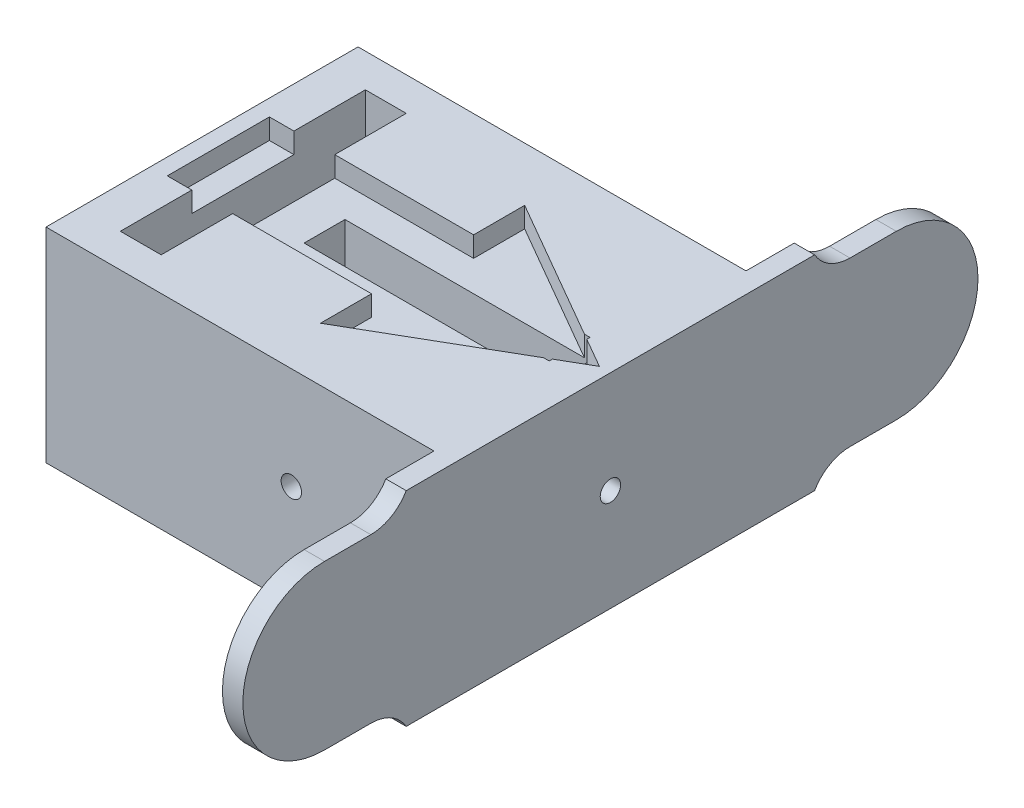
from build123d import *

# Parameters (mm, degrees)
SKETCH1_W           = 200
SKETCH1_H           = 200
BOSS_EXTRUDE2_DEPTH = 100
BOSS_EXTRUDE3_DEPTH = 10
CUT_EXTRUDE1_DEPTH  = 10
SKETCH4_W           = 120
SKETCH4_H           = 20
SKETCH4_W_2         = 20
SKETCH4_H_2         = 120
CUT_EXTRUDE2_DEPTH  = 229.910462845
SKETCH5_R           = 5
CUT_EXTRUDE3_DEPTH  = 314.687742827
SKETCH6_R           = 5
CUT_EXTRUDE4_DEPTH  = 288.054001888
SKETCH7_W           = 103.597474358
SKETCH7_H           = 100
CUT_EXTRUDE7_DEPTH  = 281.178514522
FILLET1_R           = 20


with BuildPart() as part:
    # Sketch1 → Boss-Extrude2 (new body)
    with BuildSketch(Plane(origin=(0, 0, 0), x_dir=(1, 0, 0), z_dir=(0, 1, 0))):
        Rectangle(SKETCH1_W, SKETCH1_H)
    extrude(amount=BOSS_EXTRUDE2_DEPTH)

    # Sketch2 → Boss-Extrude3 (add)
    with BuildSketch(Plane.ZY.offset(-100)):
        with BuildLine():
            Line((140, 10), (-140, 10))
            ThreePointArc((-140, 10), (-180, 50), (-140, 90))
            Line((-140, 90), (140, 90))
            ThreePointArc((140, 90), (180, 50), (140, 10))
        make_face()
    extrude(amount=BOSS_EXTRUDE3_DEPTH)

    # Sketch3 → Cut-Extrude1 (cut)
    with BuildSketch(Plane(origin=(0, 100, 0), x_dir=(1, 0, 0), z_dir=(0, 1, 0))):
        Polygon((8, 25), (8, 50), (94.602540378, 0), (8, -50), (8, -25), (-92, -25), (-92, 25), align=None)
    extrude(amount=-CUT_EXTRUDE1_DEPTH, mode=Mode.SUBTRACT)

    # Sketch4 → Cut-Extrude2 (cut, through all)
    with BuildSketch(Plane(origin=(0, 100, 0), x_dir=(1, 0, 0), z_dir=(0, 1, 0))):
        with Locations((20, 0)):
            Rectangle(SKETCH4_W, SKETCH4_H)
        with Locations((-70, 0)):
            Rectangle(SKETCH4_W_2, SKETCH4_H_2)
    extrude(amount=-CUT_EXTRUDE2_DEPTH, mode=Mode.SUBTRACT)

    # Sketch5 → Cut-Extrude3 (cut, through all)
    with BuildSketch(Plane.XY.offset(100)):
        with Locations((20.147207668, 50)):
            Circle(SKETCH5_R)
    extrude(amount=-CUT_EXTRUDE3_DEPTH, mode=Mode.SUBTRACT)

    # Sketch6 → Cut-Extrude4 (cut, through all)
    with BuildSketch(Plane.ZY.offset(100)):
        with Locations((0, 50)):
            Circle(SKETCH6_R)
    extrude(amount=-CUT_EXTRUDE4_DEPTH, mode=Mode.SUBTRACT)

    # Sketch7 → Cut-Extrude7 (cut, through all)
    with BuildSketch(Plane.ZY.offset(-90)):
        with Locations((-128.201262821, 50)):
            Rectangle(SKETCH7_W, SKETCH7_H)
        with Locations((128.201262821, 50)):
            Rectangle(SKETCH7_W, SKETCH7_H)
    extrude(amount=CUT_EXTRUDE7_DEPTH, mode=Mode.SUBTRACT)

    # Fillet1
    # the kernel refuses this fillet: 20 mm, written as the material it adds along each edge
    with BuildSketch(Plane(origin=(100, 10, -100), x_dir=(0, -1, 0), z_dir=(-1, 0, 0)), Plane(origin=(90, 10, 100), x_dir=(0, -1, 0), z_dir=(1, 0, 0))) as fillet1_piece_1:
        with BuildLine():
            CenterArc((20, -17.320508076), FILLET1_R, 120, 60)
            Line((0, -17.320508076), (-0.4, -17.320508076))
            Line((-0.4, -17.320508076), (-0.4, 0))
            Line((-0.4, 0), (0, 0.4))
            ThreePointArc((0, 0.4), (5, 0.4), (9.8, 0.346410162))
            Line((9.8, 0.346410162), (10, 0))
        make_face()
    extrude(amount=10)
    with BuildSketch(Plane(origin=(90, 90, -100), x_dir=(0, 0, -1), z_dir=(1, 0, 0)), Plane(origin=(100, 90, 100), x_dir=(0, 0, 1), z_dir=(-1, 0, 0))) as fillet1_piece_2:
        with BuildLine():
            CenterArc((17.320508076, 20), FILLET1_R, 210, 60)
            Line((0, 10), (-0.346410162, 9.8))
            ThreePointArc((-0.346410162, 9.8), (-0.4, 5), (-0.4, 0))
            Line((-0.4, 0), (0, -0.4))
            Line((0, -0.4), (17.320508076, -0.4))
            Line((17.320508076, -0.4), (17.320508076, 0))
        make_face()
    extrude(amount=10)


solid = part.part
